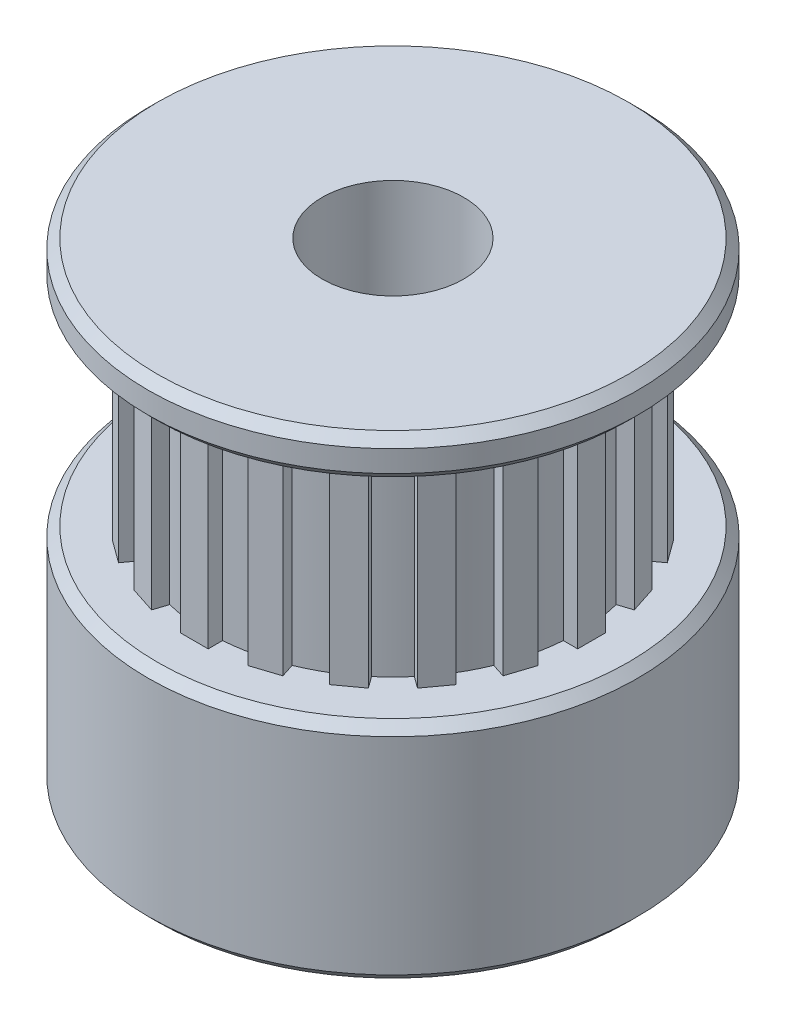
from build123d import *

# Parameters (mm, degrees)
SKETCH1_R           = 7.95
SKETCH1_R_2         = 2.3
BOSS_EXTRUDE1_DEPTH = 7.3
SKETCH2_R           = 2.3
BOSS_EXTRUDE2_DEPTH = 6.8
SKETCH3_R           = 7.95
SKETCH3_R_2         = 2.3
BOSS_EXTRUDE3_DEPTH = 1.3
CHAMFER1_SIZE       = 0.3


with BuildPart() as part:
    # Sketch1 → Boss-Extrude1 (new body)
    with BuildSketch(Plane(origin=(0, 0, 0), x_dir=(1, 0, 0), z_dir=(0, 1, 0))):
        Circle(SKETCH1_R)
        Circle(SKETCH1_R_2, mode=Mode.SUBTRACT)
    extrude(amount=BOSS_EXTRUDE1_DEPTH)

    # Sketch2 → Boss-Extrude2 (add)
    with BuildSketch(Plane(origin=(0, 7.3, 0), x_dir=(1, 0, 0), z_dir=(0, 1, 0))):
        with BuildLine():
            Line((2.421135046, 5.995256883), (1.565184181, 6.273372178))
            Line((1.565184181, 6.273372178), (1.420904518, 5.829325034))
            ThreePointArc((1.420904518, 5.829325034), (0.940180075, 5.925880646), (0.453176822, 5.98286142))
            ThreePointArc((0.453176822, 5.98286142), (0.451588427, 5.982981522), (0.45, 5.983101203))
            Line((0.45, 5.983101203), (0.45, 6.45))
            Line((0.45, 6.45), (-0.45, 6.45))
            Line((-0.45, 6.45), (-0.45, 5.983101203))
            ThreePointArc((-0.45, 5.983101203), (-0.93860679, 5.926130044), (-1.420904518, 5.829325034))
            Line((-1.420904518, 5.829325034), (-1.565184181, 6.273372178))
            Line((-1.565184181, 6.273372178), (-2.421135046, 5.995256883))
            Line((-2.421135046, 5.995256883), (-2.276855383, 5.551209739))
            ThreePointArc((-2.276855383, 5.551209739), (-2.723942998, 5.346039145), (-3.152721002, 5.104933915))
            Line((-3.152721002, 5.104933915), (-3.42715723, 5.482662977))
            Line((-3.42715723, 5.482662977), (-4.155272525, 4.95365625))
            Line((-4.155272525, 4.95365625), (-3.880836297, 4.575927188))
            ThreePointArc((-3.880836297, 4.575927188), (-4.242640687, 4.242640687), (-4.575927188, 3.880836297))
            Line((-4.575927188, 3.880836297), (-4.95365625, 4.155272525))
            Line((-4.95365625, 4.155272525), (-5.482662977, 3.42715723))
            Line((-5.482662977, 3.42715723), (-5.104933915, 3.152721002))
            ThreePointArc((-5.104933915, 3.152721002), (-5.346039145, 2.723942998), (-5.551209739, 2.276855383))
            Line((-5.551209739, 2.276855383), (-5.995256883, 2.421135046))
            Line((-5.995256883, 2.421135046), (-6.273372178, 1.565184181))
            Line((-6.273372178, 1.565184181), (-5.829325034, 1.420904518))
            ThreePointArc((-5.829325034, 1.420904518), (-5.926130044, 0.93860679), (-5.983101203, 0.45))
            Line((-5.983101203, 0.45), (-6.45, 0.45))
            Line((-6.45, 0.45), (-6.45, -0.45))
            Line((-6.45, -0.45), (-5.983101203, -0.45))
            ThreePointArc((-5.983101203, -0.45), (-5.926130044, -0.93860679), (-5.829325034, -1.420904518))
            Line((-5.829325034, -1.420904518), (-6.273372178, -1.565184181))
            Line((-6.273372178, -1.565184181), (-5.995256883, -2.421135046))
            Line((-5.995256883, -2.421135046), (-5.551209739, -2.276855383))
            ThreePointArc((-5.551209739, -2.276855383), (-5.346039145, -2.723942998), (-5.104933915, -3.152721002))
            Line((-5.104933915, -3.152721002), (-5.482662977, -3.42715723))
            Line((-5.482662977, -3.42715723), (-4.95365625, -4.155272525))
            Line((-4.95365625, -4.155272525), (-4.575927188, -3.880836297))
            ThreePointArc((-4.575927188, -3.880836297), (-4.242640687, -4.242640687), (-3.880836297, -4.575927188))
            Line((-3.880836297, -4.575927188), (-4.155272525, -4.95365625))
            Line((-4.155272525, -4.95365625), (-3.42715723, -5.482662977))
            Line((-3.42715723, -5.482662977), (-3.152721002, -5.104933915))
            ThreePointArc((-3.152721002, -5.104933915), (-2.723942998, -5.346039145), (-2.276855383, -5.551209739))
            Line((-2.276855383, -5.551209739), (-2.421135046, -5.995256883))
            Line((-2.421135046, -5.995256883), (-1.565184181, -6.273372178))
            Line((-1.565184181, -6.273372178), (-1.420904518, -5.829325034))
            ThreePointArc((-1.420904518, -5.829325034), (-0.93860679, -5.926130044), (-0.45, -5.983101203))
            Line((-0.45, -5.983101203), (-0.45, -6.45))
            Line((-0.45, -6.45), (0.45, -6.45))
            Line((0.45, -6.45), (0.45, -5.983101203))
            ThreePointArc((0.45, -5.983101203), (0.93860679, -5.926130044), (1.420904518, -5.829325034))
            Line((1.420904518, -5.829325034), (1.565184181, -6.273372178))
            Line((1.565184181, -6.273372178), (2.421135046, -5.995256883))
            Line((2.421135046, -5.995256883), (2.276855383, -5.551209739))
            ThreePointArc((2.276855383, -5.551209739), (2.723942998, -5.346039145), (3.152721002, -5.104933915))
            Line((3.152721002, -5.104933915), (3.42715723, -5.482662977))
            Line((3.42715723, -5.482662977), (4.155272525, -4.95365625))
            Line((4.155272525, -4.95365625), (3.880836297, -4.575927188))
            ThreePointArc((3.880836297, -4.575927188), (4.242640687, -4.242640687), (4.575927188, -3.880836297))
            Line((4.575927188, -3.880836297), (4.95365625, -4.155272525))
            Line((4.95365625, -4.155272525), (5.482662977, -3.42715723))
            Line((5.482662977, -3.42715723), (5.104933915, -3.152721002))
            ThreePointArc((5.104933915, -3.152721002), (5.346039145, -2.723942998), (5.551209739, -2.276855383))
            Line((5.551209739, -2.276855383), (5.995256883, -2.421135046))
            Line((5.995256883, -2.421135046), (6.273372178, -1.565184181))
            Line((6.273372178, -1.565184181), (5.829325034, -1.420904518))
            ThreePointArc((5.829325034, -1.420904518), (5.926130044, -0.93860679), (5.983101203, -0.45))
            Line((5.983101203, -0.45), (6.45, -0.45))
            Line((6.45, -0.45), (6.45, 0.45))
            Line((6.45, 0.45), (5.983101203, 0.45))
            ThreePointArc((5.983101203, 0.45), (5.926130044, 0.93860679), (5.829325034, 1.420904518))
            Line((5.829325034, 1.420904518), (6.273372178, 1.565184181))
            Line((6.273372178, 1.565184181), (5.995256883, 2.421135046))
            Line((5.995256883, 2.421135046), (5.551209739, 2.276855383))
            ThreePointArc((5.551209739, 2.276855383), (5.346039145, 2.723942998), (5.104933915, 3.152721002))
            Line((5.104933915, 3.152721002), (5.482662977, 3.42715723))
            Line((5.482662977, 3.42715723), (4.95365625, 4.155272525))
            Line((4.95365625, 4.155272525), (4.575927188, 3.880836297))
            ThreePointArc((4.575927188, 3.880836297), (4.242640687, 4.242640687), (3.880836297, 4.575927188))
            Line((3.880836297, 4.575927188), (4.155272525, 4.95365625))
            Line((4.155272525, 4.95365625), (3.42715723, 5.482662977))
            Line((3.42715723, 5.482662977), (3.152721002, 5.104933915))
            ThreePointArc((3.152721002, 5.104933915), (2.723942998, 5.346039145), (2.276855383, 5.551209739))
            Line((2.276855383, 5.551209739), (2.421135046, 5.995256883))
        make_face()
        Circle(SKETCH2_R, mode=Mode.SUBTRACT)
    extrude(amount=BOSS_EXTRUDE2_DEPTH)

    # Sketch3 → Boss-Extrude3 (add)
    with BuildSketch(Plane(origin=(0, 14.1, 0), x_dir=(1, 0, 0), z_dir=(0, 1, 0))):
        Circle(SKETCH3_R)
        Circle(SKETCH3_R_2, mode=Mode.SUBTRACT)
    extrude(amount=BOSS_EXTRUDE3_DEPTH)

    # Chamfer1
    chamfer1_edges = [part.edges().sort_by_distance(p)[0] for p in [
        (-7.95, 0, 0),
        (-7.95, 7.3, 0),
        (-7.95, 14.1, 0),
        (-7.95, 15.4, 0),
    ]]
    chamfer(chamfer1_edges, length=CHAMFER1_SIZE)


solid = part.part
